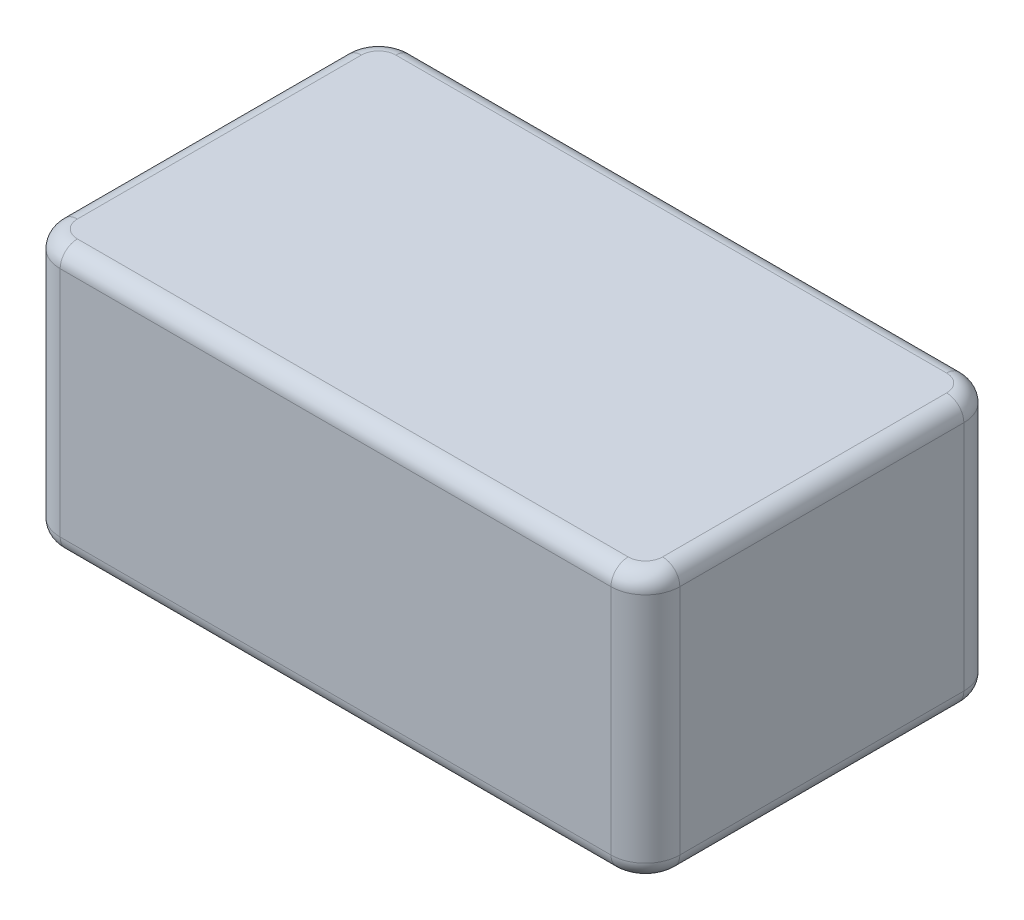
from build123d import *

# Parameters (mm, degrees)
SKETCH1_W           = 36
SKETCH1_H           = 20.5
BOSS_EXTRUDE1_DEPTH = 15.5
FILLET1_R           = 2
FILLET2_R           = 1


with BuildPart() as part:
    # Sketch1 → Boss-Extrude1 (new body)
    with BuildSketch(Plane(origin=(0, 0, 0), x_dir=(1, 0, 0), z_dir=(0, 1, 0))):
        with Locations((18, 10.25)):
            Rectangle(SKETCH1_W, SKETCH1_H)
    extrude(amount=BOSS_EXTRUDE1_DEPTH)

    # Fillet1
    fillet1_edges = [part.edges().sort_by_distance(p)[0] for p in [
        (0, 7.75, -20.5),
        (36, 7.75, -20.5),
        (36, 7.75, 0),
        (0, 7.75, 0),
    ]]
    fillet(fillet1_edges, radius=FILLET1_R)

    # Fillet2
    fillet2_edges = [part.edges().sort_by_distance(p)[0] for p in [
        (0.585786438, 0, -0.585786438),
        (0, 0, -10.25),
        (0.585786438, 0, -19.914213562),
        (18, 0, -20.5),
        (35.414213562, 0, -19.914213562),
        (36, 0, -10.25),
        (35.414213562, 0, -0.585786438),
        (0.585786438, 15.5, -0.585786438),
        (0, 15.5, -10.25),
        (0.585786438, 15.5, -19.914213562),
        (18, 15.5, -20.5),
        (35.414213562, 15.5, -19.914213562),
        (36, 15.5, -10.25),
        (35.414213562, 15.5, -0.585786438),
        (18, 0, 0),
        (18, 15.5, 0),
    ]]
    fillet(fillet2_edges, radius=FILLET2_R)


solid = part.part
